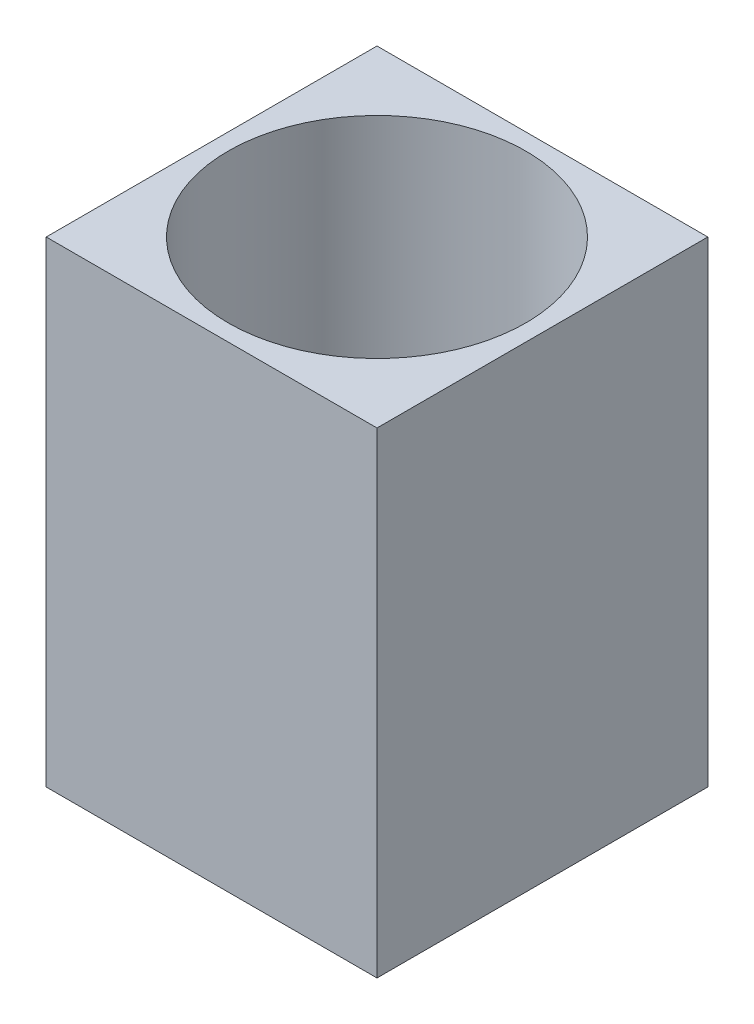
from build123d import *

# Parameters (mm, degrees)
SKETCH1_W           = 635
SKETCH1_H           = 635
SKETCH1_R           = 285.75
BOSS_EXTRUDE1_DEPTH = 457.2


with BuildPart() as part:
    # Sketch1 → Boss-Extrude1 (new, symmetric)
    with BuildSketch(Plane(origin=(0, 0, 0), x_dir=(1, 0, 0), z_dir=(0, 1, 0))):
        Rectangle(SKETCH1_W, SKETCH1_H)
        Circle(SKETCH1_R, mode=Mode.SUBTRACT)
    extrude(amount=BOSS_EXTRUDE1_DEPTH, both=True)


solid = part.part
